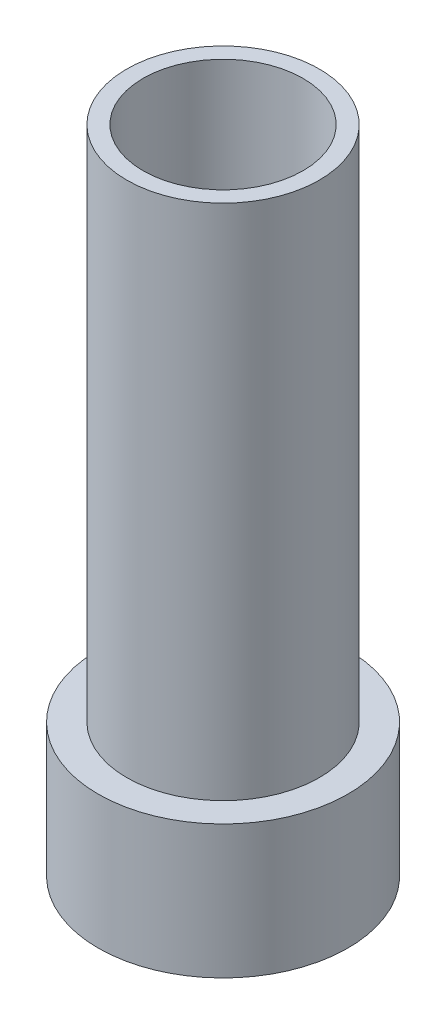
from build123d import *

# Parameters (mm, degrees)
SKETCH1_R           = 4.68
BOSS_EXTRUDE1_DEPTH = 5
SKETCH2_R           = 3.61
SKETCH2_R_2         = 3
BOSS_EXTRUDE2_DEPTH = 19.4
SKETCH3_R           = 3
BOSS_EXTRUDE4_DEPTH = 14.05


with BuildPart() as part:
    # Sketch1 → Boss-Extrude1 (new body)
    with BuildSketch(Plane(origin=(0, 0, 0), x_dir=(1, 0, 0), z_dir=(0, 1, 0))):
        Circle(SKETCH1_R)
    extrude(amount=BOSS_EXTRUDE1_DEPTH)

    # Sketch2 → Boss-Extrude2 (add)
    with BuildSketch(Plane(origin=(0, 5, 0), x_dir=(1, 0, 0), z_dir=(0, 1, 0))):
        Circle(SKETCH2_R)
        Circle(SKETCH2_R_2, mode=Mode.SUBTRACT)
    extrude(amount=BOSS_EXTRUDE2_DEPTH)

    # Sketch3 → Boss-Extrude4 (add)
    with BuildSketch(Plane(origin=(0, 5, 0), x_dir=(1, 0, 0), z_dir=(0, 1, 0))):
        Circle(SKETCH3_R)
    extrude(amount=BOSS_EXTRUDE4_DEPTH)


solid = part.part
